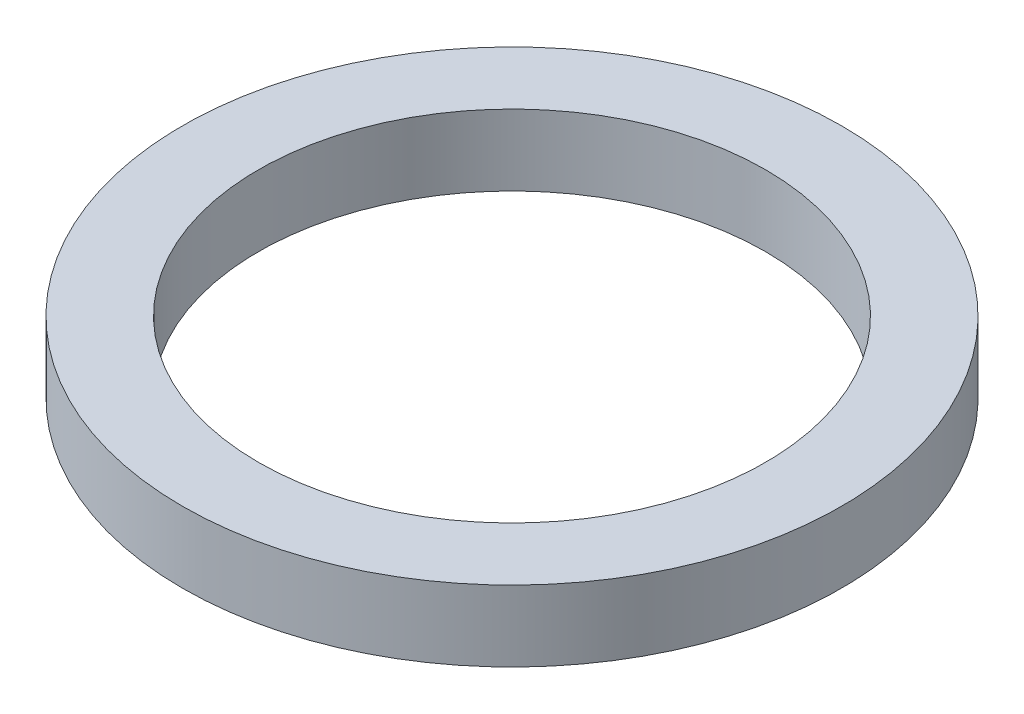
from build123d import *

# Parameters (mm, degrees)
SKETCH3_R           = 32.5
SKETCH3_R_2         = 25
BOSS_EXTRUDE3_DEPTH = 7


with BuildPart() as part:
    # Sketch3 → Boss-Extrude3 (new body)
    with BuildSketch(Plane(origin=(0, 0, 0), x_dir=(1, 0, 0), z_dir=(0, 1, 0))):
        Circle(SKETCH3_R)
        Circle(SKETCH3_R_2, mode=Mode.SUBTRACT)
    extrude(amount=BOSS_EXTRUDE3_DEPTH)


solid = part.part
